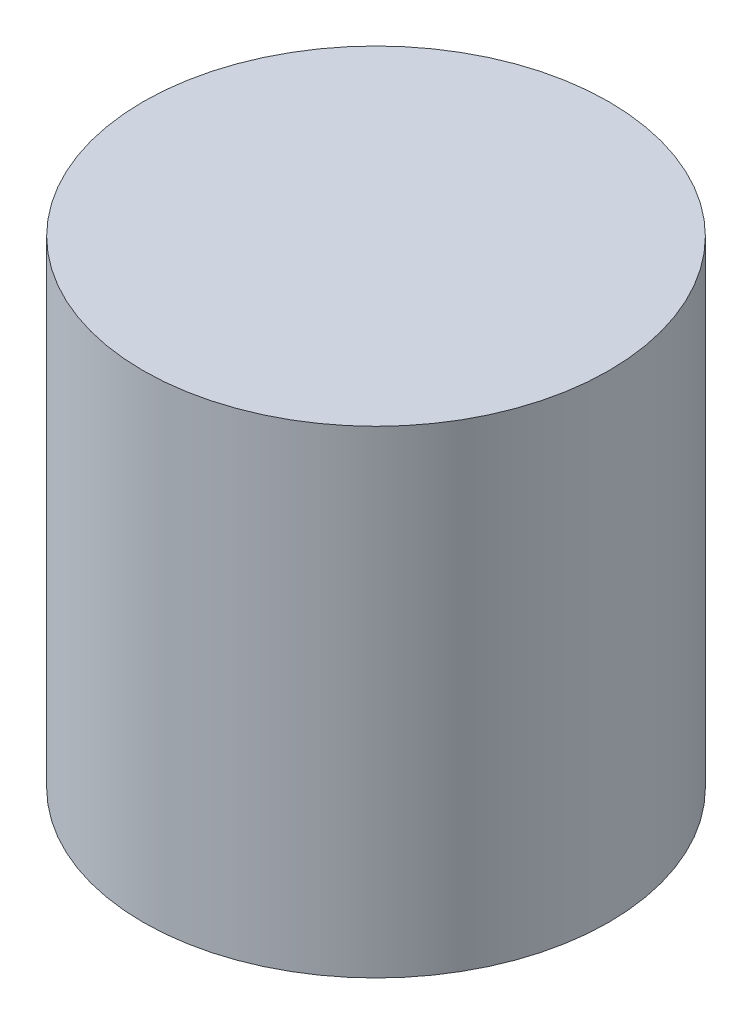
from build123d import *

# Parameters (mm, degrees)
SKETCH1_R           = 19.5
BOSS_EXTRUDE1_DEPTH = 3
BOSS_EXTRUDE2_START = 37
SKETCH2_R           = 19.5
SKETCH2_R_2         = 18
BOSS_EXTRUDE2_DEPTH = 37
FILLET1_R           = 5
BOSS_EXTRUDE3_START = -6
SKETCH3_R           = 18
SKETCH3_R_2         = 17.4
BOSS_EXTRUDE3_DEPTH = 6


with BuildPart() as part:
    # Sketch1 → Boss-Extrude1 (new body)
    with BuildSketch(Plane(origin=(0, 0, 0), x_dir=(1, 0, 0), z_dir=(0, 1, 0))):
        with Locations(Location((0, 0, 0), (0, 0, 270))):
            Circle(SKETCH1_R)
    extrude(amount=BOSS_EXTRUDE1_DEPTH)

    # Sketch2 → Boss-Extrude2 (add)
    with BuildSketch(Plane(origin=(0, 0, 0), x_dir=(-1, 0, 0), z_dir=(0, -1, 0)).offset(BOSS_EXTRUDE2_START)):
        with Locations(Location((0, 0, 0), (0, 0, 90))):
            Circle(SKETCH2_R)
        with Locations(Location((0, 0, 0), (0, 0, 90))):
            Circle(SKETCH2_R_2, mode=Mode.SUBTRACT)
    extrude(amount=-BOSS_EXTRUDE2_DEPTH)

    # Fillet1
    # the kernel refuses this fillet: 5 mm, written as the material it takes off along each edge
    with BuildSketch(Plane(origin=(0, -37, 0), x_dir=(0, 0, -1), z_dir=(-1, 0, 0))) as fillet1_piece_1:
        with BuildLine():
            CenterArc((23, -3.570714214), FILLET1_R, 134.427004001, 45.572995999)
            Line((18, -3.570714214), (17.9, -3.570714214))
            Line((17.9, -3.570714214), (17.9, 0))
            Line((17.9, 0), (18, 0.1))
            ThreePointArc((18, 0.1), (18.75, 0.1), (19.43, 0.071414284))
            Line((19.43, 0.071414284), (19.5, 0))
        make_face()
    revolve(axis=Axis((0, -37, 0), (0, -1, 0)), mode=Mode.SUBTRACT)

    # Sketch3 → Boss-Extrude3 (add)
    with BuildSketch(Plane(origin=(0, 3, 0), x_dir=(1, 0, 0), z_dir=(0, 1, 0)).offset(BOSS_EXTRUDE3_START)):
        with Locations(Location((0, 0, 0), (0, 0, 270))):
            Circle(SKETCH3_R)
        with Locations(Location((0, 0, 0), (0, 0, 270))):
            Circle(SKETCH3_R_2, mode=Mode.SUBTRACT)
    extrude(amount=BOSS_EXTRUDE3_DEPTH)


solid = part.part
